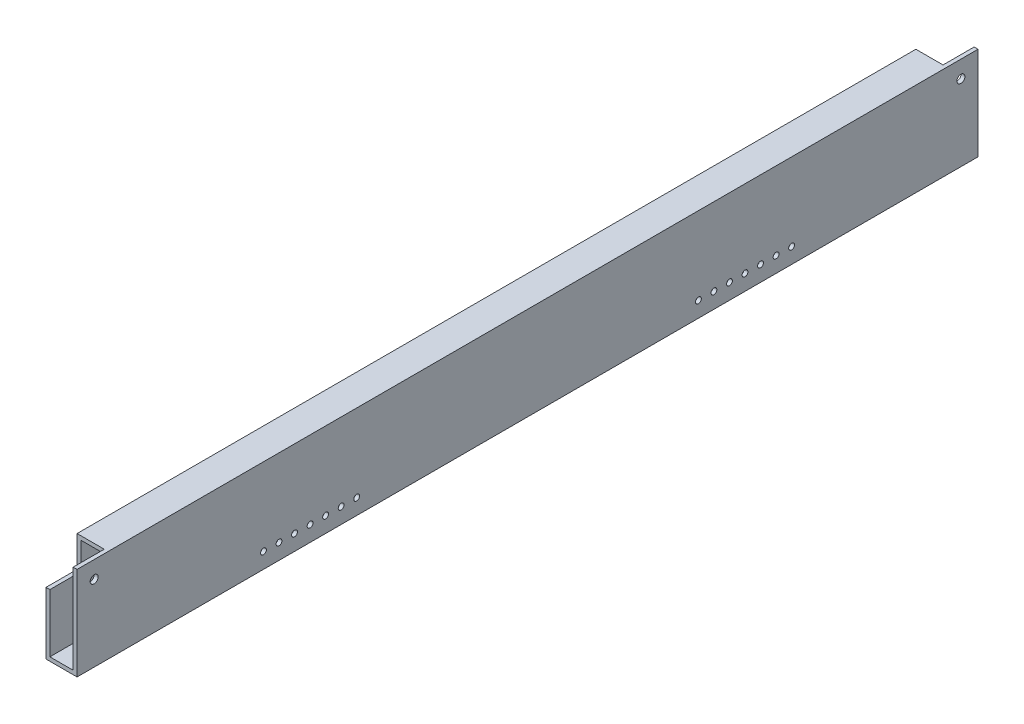
from build123d import *

# Parameters (mm, degrees)
SKETCH1_W           = 25.4
SKETCH1_H           = 76.2
BOSS_EXTRUDE1_DEPTH = 368.3
SHELL1_T            = -3.175
CUT_EXTRUDE2_REACH  = 373.136
SKETCH3_R           = 2.38125
SKETCH4_W           = 25.4
SKETCH4_H           = 25.4
CUT_EXTRUDE3_DEPTH  = 22.225
SKETCH5_R           = 3.25
CUT_EXTRUDE4_DEPTH  = 22.225


with BuildPart() as part:
    # Sketch1 → Boss-Extrude1 (new, symmetric)
    with BuildSketch(Plane.XY):
        Rectangle(SKETCH1_W, SKETCH1_H)
    extrude(amount=BOSS_EXTRUDE1_DEPTH, both=True)

    # Shell1
    shell1_openings = [part.faces().sort_by_distance(p)[0] for p in [
        (0, 0, -368.3),
        (0, 0, 368.3),
    ]]
    offset(amount=SHELL1_T, openings=shell1_openings, kind=Kind.INTERSECTION)

    # Sketch3 → Cut-Extrude2 (cut, up to next)
    with BuildSketch(Plane(origin=(12.7, 0, 0), x_dir=(0, 0, -1), z_dir=(1, 0, 0)), mode=Mode.PRIVATE) as cut_extrude2_sk1:
        with Locations((215.9, -25.4)):
            Circle(SKETCH3_R)
    cut_extrude2_tool1 = extrude(cut_extrude2_sk1.sketch, amount=-CUT_EXTRUDE2_REACH, mode=Mode.PRIVATE) & part.part
    # Sketch3 → Cut-Extrude2 (cut, up to next)
    with BuildSketch(Plane(origin=(12.7, 0, 0), x_dir=(0, 0, -1), z_dir=(1, 0, 0)), mode=Mode.PRIVATE) as cut_extrude2_sk2:
        with Locations((203.2, -25.4)):
            Circle(SKETCH3_R)
    cut_extrude2_tool2 = extrude(cut_extrude2_sk2.sketch, amount=-CUT_EXTRUDE2_REACH, mode=Mode.PRIVATE) & part.part
    # Sketch3 → Cut-Extrude2 (cut, up to next)
    with BuildSketch(Plane(origin=(12.7, 0, 0), x_dir=(0, 0, -1), z_dir=(1, 0, 0)), mode=Mode.PRIVATE) as cut_extrude2_sk3:
        with Locations((190.5, -25.4)):
            Circle(SKETCH3_R)
    cut_extrude2_tool3 = extrude(cut_extrude2_sk3.sketch, amount=-CUT_EXTRUDE2_REACH, mode=Mode.PRIVATE) & part.part
    # Sketch3 → Cut-Extrude2 (cut, up to next)
    with BuildSketch(Plane(origin=(12.7, 0, 0), x_dir=(0, 0, -1), z_dir=(1, 0, 0)), mode=Mode.PRIVATE) as cut_extrude2_sk4:
        with Locations((177.8, -25.4)):
            Circle(SKETCH3_R)
    cut_extrude2_tool4 = extrude(cut_extrude2_sk4.sketch, amount=-CUT_EXTRUDE2_REACH, mode=Mode.PRIVATE) & part.part
    # Sketch3 → Cut-Extrude2 (cut, up to next)
    with BuildSketch(Plane(origin=(12.7, 0, 0), x_dir=(0, 0, -1), z_dir=(1, 0, 0)), mode=Mode.PRIVATE) as cut_extrude2_sk5:
        with Locations((165.1, -25.4)):
            Circle(SKETCH3_R)
    cut_extrude2_tool5 = extrude(cut_extrude2_sk5.sketch, amount=-CUT_EXTRUDE2_REACH, mode=Mode.PRIVATE) & part.part
    # Sketch3 → Cut-Extrude2 (cut, up to next)
    with BuildSketch(Plane(origin=(12.7, 0, 0), x_dir=(0, 0, -1), z_dir=(1, 0, 0)), mode=Mode.PRIVATE) as cut_extrude2_sk6:
        with Locations((152.4, -25.4)):
            Circle(SKETCH3_R)
    cut_extrude2_tool6 = extrude(cut_extrude2_sk6.sketch, amount=-CUT_EXTRUDE2_REACH, mode=Mode.PRIVATE) & part.part
    # Sketch3 → Cut-Extrude2 (cut, up to next)
    with BuildSketch(Plane(origin=(12.7, 0, 0), x_dir=(0, 0, -1), z_dir=(1, 0, 0)), mode=Mode.PRIVATE) as cut_extrude2_sk7:
        with Locations((139.7, -25.4)):
            Circle(SKETCH3_R)
    cut_extrude2_tool7 = extrude(cut_extrude2_sk7.sketch, amount=-CUT_EXTRUDE2_REACH, mode=Mode.PRIVATE) & part.part
    # Sketch3 → Cut-Extrude2 (cut, up to next)
    with BuildSketch(Plane(origin=(12.7, 0, 0), x_dir=(0, 0, -1), z_dir=(1, 0, 0)), mode=Mode.PRIVATE) as cut_extrude2_sk8:
        with Locations((-139.7, -25.4)):
            Circle(SKETCH3_R)
    cut_extrude2_tool8 = extrude(cut_extrude2_sk8.sketch, amount=-CUT_EXTRUDE2_REACH, mode=Mode.PRIVATE) & part.part
    # Sketch3 → Cut-Extrude2 (cut, up to next)
    with BuildSketch(Plane(origin=(12.7, 0, 0), x_dir=(0, 0, -1), z_dir=(1, 0, 0)), mode=Mode.PRIVATE) as cut_extrude2_sk9:
        with Locations((-152.4, -25.4)):
            Circle(SKETCH3_R)
    cut_extrude2_tool9 = extrude(cut_extrude2_sk9.sketch, amount=-CUT_EXTRUDE2_REACH, mode=Mode.PRIVATE) & part.part
    # Sketch3 → Cut-Extrude2 (cut, up to next)
    with BuildSketch(Plane(origin=(12.7, 0, 0), x_dir=(0, 0, -1), z_dir=(1, 0, 0)), mode=Mode.PRIVATE) as cut_extrude2_sk10:
        with Locations((-165.1, -25.4)):
            Circle(SKETCH3_R)
    cut_extrude2_tool10 = extrude(cut_extrude2_sk10.sketch, amount=-CUT_EXTRUDE2_REACH, mode=Mode.PRIVATE) & part.part
    # Sketch3 → Cut-Extrude2 (cut, up to next)
    with BuildSketch(Plane(origin=(12.7, 0, 0), x_dir=(0, 0, -1), z_dir=(1, 0, 0)), mode=Mode.PRIVATE) as cut_extrude2_sk11:
        with Locations((-203.2, -25.4)):
            Circle(SKETCH3_R)
    cut_extrude2_tool11 = extrude(cut_extrude2_sk11.sketch, amount=-CUT_EXTRUDE2_REACH, mode=Mode.PRIVATE) & part.part
    # Sketch3 → Cut-Extrude2 (cut, up to next)
    with BuildSketch(Plane(origin=(12.7, 0, 0), x_dir=(0, 0, -1), z_dir=(1, 0, 0)), mode=Mode.PRIVATE) as cut_extrude2_sk12:
        with Locations((-177.8, -25.4)):
            Circle(SKETCH3_R)
    cut_extrude2_tool12 = extrude(cut_extrude2_sk12.sketch, amount=-CUT_EXTRUDE2_REACH, mode=Mode.PRIVATE) & part.part
    # Sketch3 → Cut-Extrude2 (cut, up to next)
    with BuildSketch(Plane(origin=(12.7, 0, 0), x_dir=(0, 0, -1), z_dir=(1, 0, 0)), mode=Mode.PRIVATE) as cut_extrude2_sk13:
        with Locations((-215.9, -25.4)):
            Circle(SKETCH3_R)
    cut_extrude2_tool13 = extrude(cut_extrude2_sk13.sketch, amount=-CUT_EXTRUDE2_REACH, mode=Mode.PRIVATE) & part.part
    # Sketch3 → Cut-Extrude2 (cut, up to next)
    with BuildSketch(Plane(origin=(12.7, 0, 0), x_dir=(0, 0, -1), z_dir=(1, 0, 0)), mode=Mode.PRIVATE) as cut_extrude2_sk14:
        with Locations((-190.5, -25.4)):
            Circle(SKETCH3_R)
    cut_extrude2_tool14 = extrude(cut_extrude2_sk14.sketch, amount=-CUT_EXTRUDE2_REACH, mode=Mode.PRIVATE) & part.part
    add(cut_extrude2_tool1.solids().sort_by_distance((12.7, -25.4, -215.9))[0], mode=Mode.SUBTRACT)
    add(cut_extrude2_tool2.solids().sort_by_distance((12.7, -25.4, -203.2))[0], mode=Mode.SUBTRACT)
    add(cut_extrude2_tool3.solids().sort_by_distance((12.7, -25.4, -190.5))[0], mode=Mode.SUBTRACT)
    add(cut_extrude2_tool4.solids().sort_by_distance((12.7, -25.4, -177.8))[0], mode=Mode.SUBTRACT)
    add(cut_extrude2_tool5.solids().sort_by_distance((12.7, -25.4, -165.1))[0], mode=Mode.SUBTRACT)
    add(cut_extrude2_tool6.solids().sort_by_distance((12.7, -25.4, -152.4))[0], mode=Mode.SUBTRACT)
    add(cut_extrude2_tool7.solids().sort_by_distance((12.7, -25.4, -139.7))[0], mode=Mode.SUBTRACT)
    add(cut_extrude2_tool8.solids().sort_by_distance((12.7, -25.4, 139.7))[0], mode=Mode.SUBTRACT)
    add(cut_extrude2_tool9.solids().sort_by_distance((12.7, -25.4, 152.4))[0], mode=Mode.SUBTRACT)
    add(cut_extrude2_tool10.solids().sort_by_distance((12.7, -25.4, 165.1))[0], mode=Mode.SUBTRACT)
    add(cut_extrude2_tool11.solids().sort_by_distance((12.7, -25.4, 203.2))[0], mode=Mode.SUBTRACT)
    add(cut_extrude2_tool12.solids().sort_by_distance((12.7, -25.4, 177.8))[0], mode=Mode.SUBTRACT)
    add(cut_extrude2_tool13.solids().sort_by_distance((12.7, -25.4, 215.9))[0], mode=Mode.SUBTRACT)
    add(cut_extrude2_tool14.solids().sort_by_distance((12.7, -25.4, 190.5))[0], mode=Mode.SUBTRACT)

    # Sketch4 → Cut-Extrude3 (cut)
    with BuildSketch(Plane.ZY.offset(12.7)):
        with Locations((-355.6, 25.4)):
            Rectangle(SKETCH4_W, SKETCH4_H)
        with Locations((355.6, 25.4)):
            Rectangle(SKETCH4_W, SKETCH4_H)
    extrude(amount=-CUT_EXTRUDE3_DEPTH, mode=Mode.SUBTRACT)

    # Sketch5 → Cut-Extrude4 (cut)
    with BuildSketch(Plane.ZY.offset(-9.525)):
        with Locations((-354.33, 24.13)):
            Circle(SKETCH5_R)
        with Locations((354.33, 24.13)):
            Circle(SKETCH5_R)
    extrude(amount=-CUT_EXTRUDE4_DEPTH, mode=Mode.SUBTRACT)


solid = part.part
